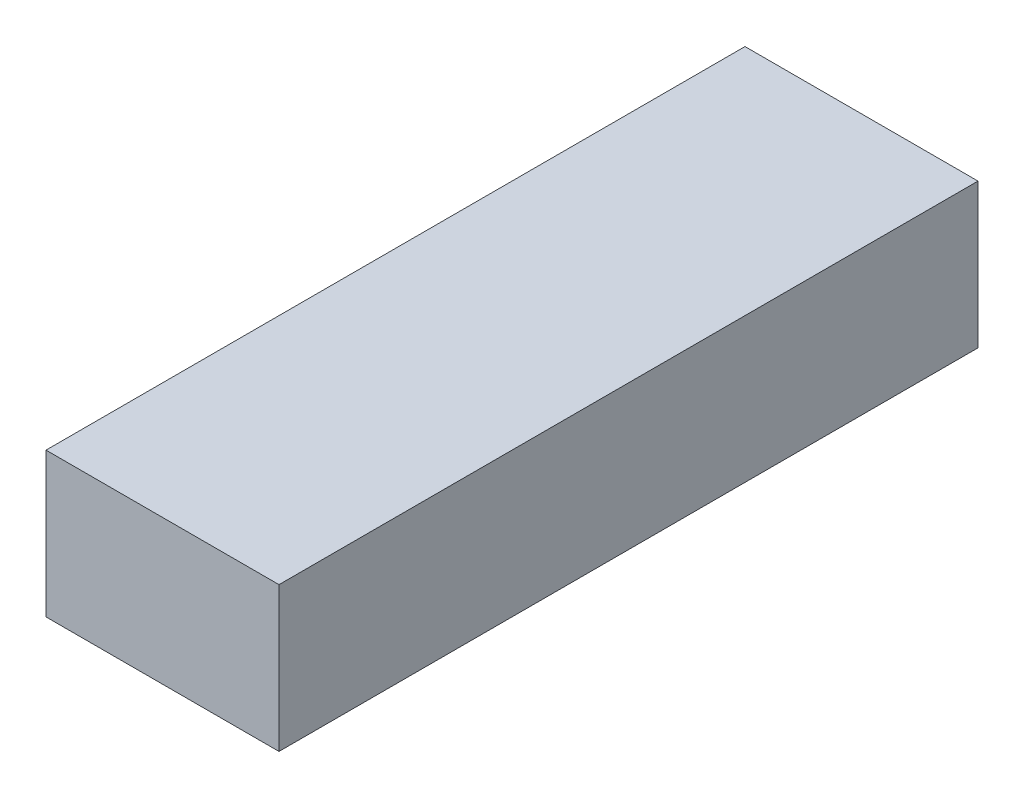
from build123d import *

# Parameters (mm, degrees)
SKETCH3_W           = 35
SKETCH3_H           = 105
BOSS_EXTRUDE1_DEPTH = 21.7


with BuildPart() as part:
    # Sketch3 → Boss-Extrude1 (new body)
    with BuildSketch(Plane(origin=(0, 0, 0), x_dir=(1, 0, 0), z_dir=(0, 1, 0))):
        with Locations((17.5, 52.5)):
            Rectangle(SKETCH3_W, SKETCH3_H)
    extrude(amount=BOSS_EXTRUDE1_DEPTH)


solid = part.part
